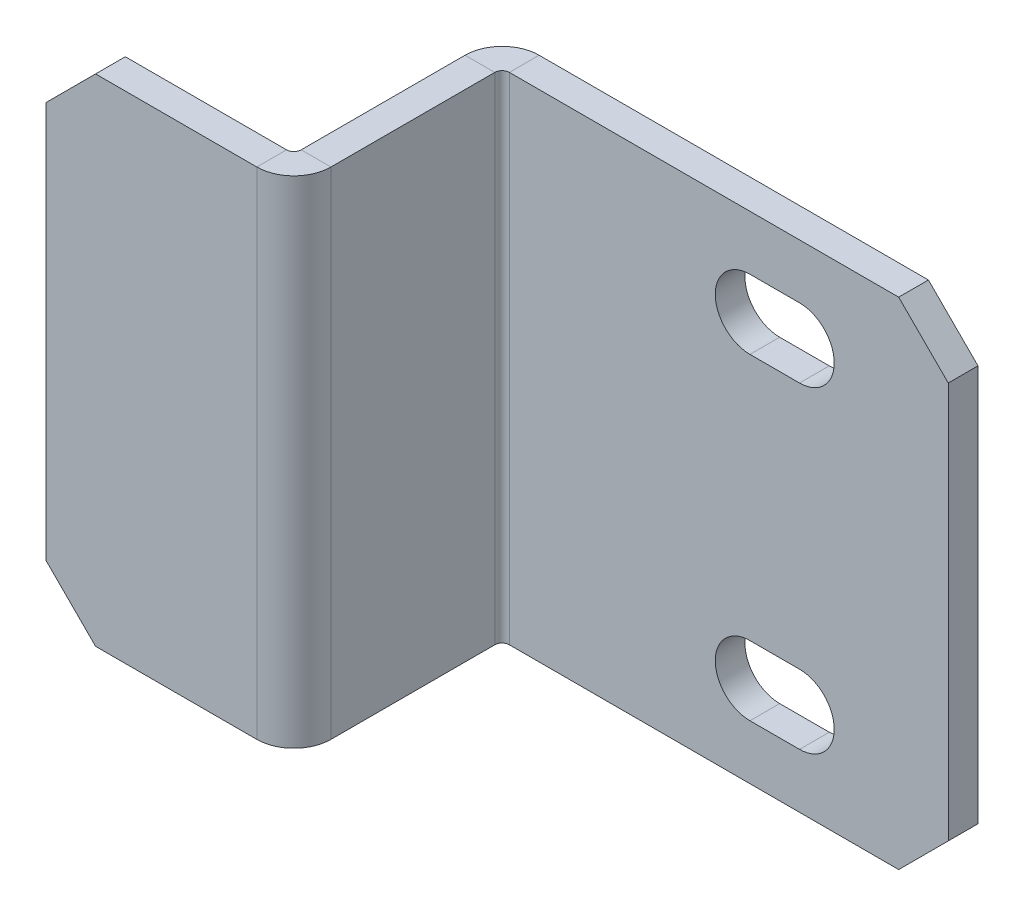
from build123d import *

# Parameters (mm, degrees)
SKETCH_1_W                       = 48
SKETCH_1_H                       = 50
SM_BASE_FLANGE_1_DEPTH           = 3
SM_EDGE_FLANGE_1_STRIP_W         = 13.4732
SM_EDGE_FLANGE_1_STRIP_H         = 3
SM_EDGE_FLANGE_1_STRIP_CUT_DEPTH = 50
SM_EDGE_FLANGE_1_DEPTH           = 50
SM_EDGE_FLANGE_2_STRIP_W         = 13.4732
SM_EDGE_FLANGE_2_STRIP_H         = 3
SM_EDGE_FLANGE_2_STRIP_CUT_DEPTH = 50
SM_EDGE_FLANGE_2_DEPTH           = 50
CHAMFER_1_SIZE                   = 5
HOLE_WIZARD_7_0_7_1_D            = 7
CUT_EXTRUDE_1_DEPTH              = 10


# Sheet-metal steps are written as plain solids
with BuildPart() as part:
    # Sketch 1 → 基体-法兰1 (new body)
    with BuildSketch(Plane.XY):
        Rectangle(SKETCH_1_W, SKETCH_1_H)
    extrude(amount=-SM_BASE_FLANGE_1_DEPTH)

    # 边线-法兰1 strip (across the edge) → 边线-法兰1 strip cut (cut)
    with BuildSketch(Plane(origin=(-24, 25, 0), x_dir=(1, 0, 0), z_dir=(0, -1, 0))):
        with Locations((-3, -1.5)):
            Rectangle(SM_EDGE_FLANGE_1_STRIP_W, SM_EDGE_FLANGE_1_STRIP_H)
    extrude(amount=SM_EDGE_FLANGE_1_STRIP_CUT_DEPTH, mode=Mode.SUBTRACT)

    # 边线-法兰1 section (across the edge) → 边线-法兰1 (add)
    with BuildSketch(Plane(origin=(-24, 25, 0), x_dir=(1, 0, 0), z_dir=(0, -1, 0))):
        with BuildLine():
            Line((0, 0.7366), (0, 21))
            Line((0, 21), (3, 21))
            Line((3, 21), (3, 0.7366))
            ThreePointArc((3, 0.7366), (3.215745145, 0.215745145), (3.7366, 0))
            Line((3.7366, 0), (3.7366, -3))
            ThreePointArc((3.7366, -3), (1.094424801, -1.905575199), (0, 0.7366))
        make_face()
    extrude(amount=SM_EDGE_FLANGE_1_DEPTH)

    # 边线-法兰2 strip (across the edge) → 边线-法兰2 strip cut (cut)
    with BuildSketch(Plane(origin=(-24, -25, 21), x_dir=(0, 0, -1), z_dir=(0, 1, 0))):
        with Locations((-3, -1.5)):
            Rectangle(SM_EDGE_FLANGE_2_STRIP_W, SM_EDGE_FLANGE_2_STRIP_H)
    extrude(amount=SM_EDGE_FLANGE_2_STRIP_CUT_DEPTH, mode=Mode.SUBTRACT)

    # 边线-法兰2 section (across the edge) → 边线-法兰2 (add)
    with BuildSketch(Plane(origin=(-24, -25, 21), x_dir=(0, 0, -1), z_dir=(0, 1, 0))):
        with BuildLine():
            Line((0, 0.7366), (0, 22))
            Line((0, 22), (3, 22))
            Line((3, 22), (3, 0.7366))
            ThreePointArc((3, 0.7366), (3.215745145, 0.215745145), (3.7366, 0))
            Line((3.7366, 0), (3.7366, -3))
            ThreePointArc((3.7366, -3), (1.094424801, -1.905575199), (0, 0.7366))
        make_face()
    extrude(amount=SM_EDGE_FLANGE_2_DEPTH)

    # 倒角1
    chamfer_1_edges = [part.edges().sort_by_distance(p)[0] for p in [
        (-46, -25, 19.5),
        (-46, 25, 19.5),
        (24, 25, -1.5),
        (24, -25, -1.5),
    ]]
    chamfer(chamfer_1_edges, length=CHAMFER_1_SIZE)

    # Ø7.0 (7) 直径孔1 (through all)
    with Locations(Plane(origin=(0, 0, -3), x_dir=(-1, 0, 0), z_dir=(0, 0, -1))):
        with Locations((-6.5, 16), (-6.5, -16)):
            Hole(HOLE_WIZARD_7_0_7_1_D / 2)

    # 草图14 → 切除-拉伸1 (cut)
    with BuildSketch(Plane(origin=(0, 0, -3), x_dir=(-1, 0, 0), z_dir=(0, 0, -1))):
        with BuildLine():
            Line((-9, 19.5), (-4, 19.5))
            ThreePointArc((-4, 19.5), (-0.5, 16), (-4, 12.5))
            Line((-4, 12.5), (-9, 12.5))
            ThreePointArc((-9, 12.5), (-12.5, 16), (-9, 19.5))
        make_face()
        with BuildLine():
            Line((-9, -12.5), (-4, -12.5))
            ThreePointArc((-4, -12.5), (-0.5, -16), (-4, -19.5))
            Line((-4, -19.5), (-9, -19.5))
            ThreePointArc((-9, -19.5), (-12.5, -16), (-9, -12.5))
        make_face()
    extrude(amount=-CUT_EXTRUDE_1_DEPTH, mode=Mode.SUBTRACT)


solid = part.part
